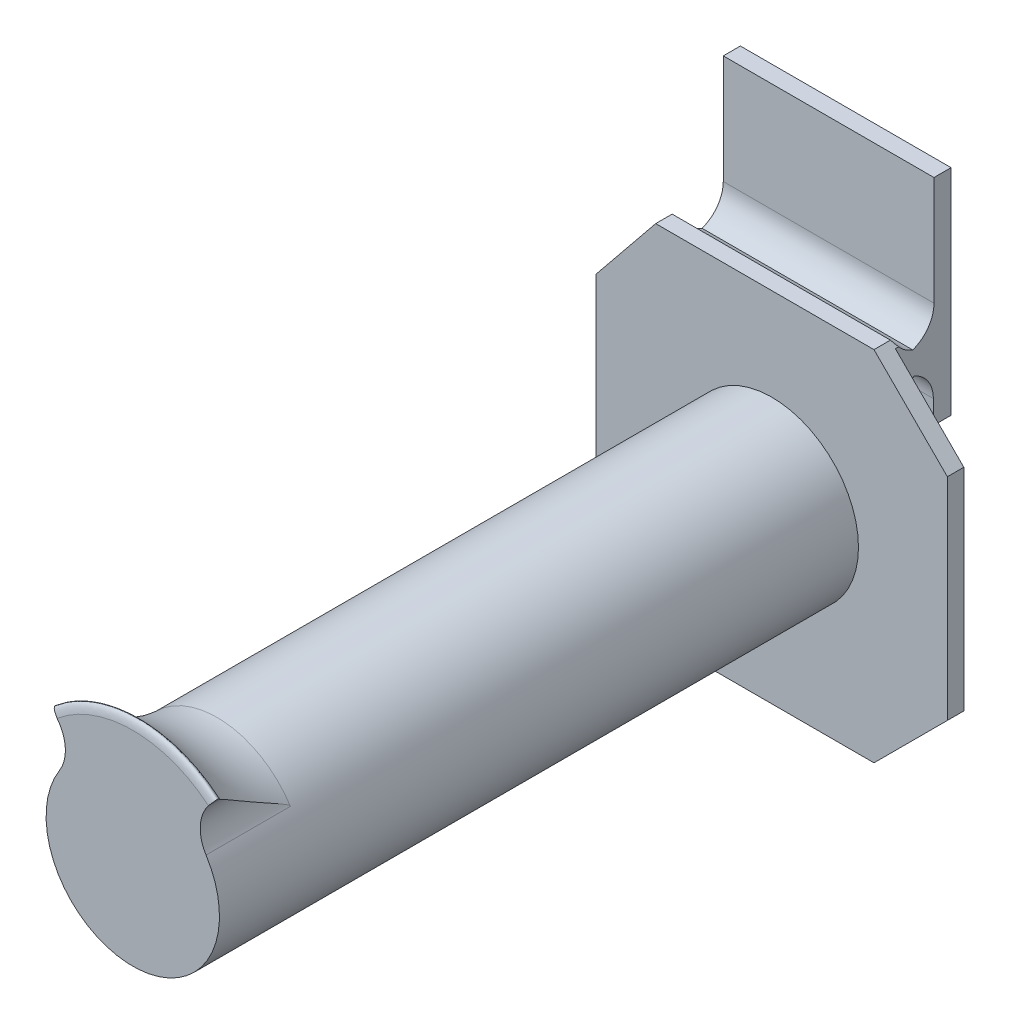
from build123d import *

# Parameters (mm, degrees)
SKETCH1_R                = 13.7
BOSS_EXTRUDE1_DEPTH      = 101
SKETCH5_W                = 55.5
SKETCH5_H                = 56.561345004
BOSS_EXTRUDE2_DEPTH      = 2.6
CUT_EXTRUDE4_DEPTH       = 2.6
BOSS_EXTRUDE4_DEPTH      = 6
SKETCH8_W                = 33.3
SKETCH8_H                = 11.7
BOSS_EXTRUDE5_DEPTH      = 2.8
SKETCH9_W                = 33.3
SKETCH9_H                = 2.7
BOSS_EXTRUDE6_DEPTH      = 22.2
FILLET2_R                = 5
REVOLVE1_ANGLE           = 40
REVOLVE1_OTHER_WAY_ANGLE = 40
FILLET4_R                = 6
FILLET5_R                = 6


with BuildPart() as part:
    # Sketch1 → Boss-Extrude1 (new body)
    with BuildSketch(Plane.XY):
        with Locations(Location((0, 0, 0), (0, 0, 180))):
            Circle(SKETCH1_R)
    extrude(amount=BOSS_EXTRUDE1_DEPTH)

    # Sketch5 → Boss-Extrude2 (add)
    with BuildSketch(Plane(origin=(0, 0, 0), x_dir=(-1, 0, 0), z_dir=(0, 0, -1))):
        Rectangle(SKETCH5_W, SKETCH5_H)
    extrude(amount=BOSS_EXTRUDE2_DEPTH)

    # Sketch6 → Cut-Extrude4 (cut)
    with BuildSketch(Plane(origin=(0, 0, -2.6), x_dir=(-1, 0, 0), z_dir=(0, 0, -1))):
        Polygon((27.75, 28.280672502), (18.35, 28.280672502), (27.75, 16.680672502), align=None)
        Polygon((-16.15, -28.280672502), (-27.75, -16.680672502), (-27.75, -28.280672502), align=None)
        Polygon((27.75, -18.880672502), (18.35, -28.280672502), (27.75, -28.280672502), align=None)
        Polygon((-27.75, 16.680672502), (-27.75, 28.280672502), (-16.15, 28.280672502), align=None)
    extrude(amount=-CUT_EXTRUDE4_DEPTH, mode=Mode.SUBTRACT)

    # Sketch7 → Boss-Extrude4 (add)
    with BuildSketch(Plane(origin=(0, 0, -2.6), x_dir=(-1, 0, 0), z_dir=(0, 0, -1))):
        Polygon((1.1, 25.680672502), (16.366645995, 25.680672502), (16.366645995, 22.680672502), (-16.933354005, 22.680672502), (-16.933354005, 25.680672502), align=None)
    extrude(amount=BOSS_EXTRUDE4_DEPTH)

    # Sketch8 → Boss-Extrude5 (add)
    with BuildSketch(Plane(origin=(0, 0, -8.6), x_dir=(-1, 0, 0), z_dir=(0, 0, -1))):
        with Locations((-0.283354005, 19.830672502)):
            Rectangle(SKETCH8_W, SKETCH8_H)
    extrude(amount=BOSS_EXTRUDE5_DEPTH)

    # Sketch9 → Boss-Extrude6 (add)
    with BuildSketch(Plane(origin=(0, 25.680672502, 0), x_dir=(1, 0, 0), z_dir=(0, 1, 0))):
        with Locations((0.283354005, 10.05)):
            Rectangle(SKETCH9_W, SKETCH9_H)
    extrude(amount=BOSS_EXTRUDE6_DEPTH)

    # Fillet2
    # the kernel refuses this fillet: 5 mm, written as the material it adds along each edge
    with BuildSketch(Plane(origin=(-16.366645995, 25.680672502, -2.6), x_dir=(0, 1, 0), z_dir=(1, 0, 0))) as fillet2_piece_1_section:
        with BuildLine():
            CenterArc((5, -4.38634244), FILLET2_R, 118.685402014, 61.314597986)
            Line((0, -4.38634244), (-0.1, -4.38634244))
            Line((-0.1, -4.38634244), (-0.1, 0))
            Line((-0.1, 0), (0, 0.1))
            ThreePointArc((0, 0.1), (1.3, 0.1), (2.552, 0.087726849))
            Line((2.552, 0.087726849), (2.6, 0))
        make_face()
    fillet2_piece_1 = extrude(amount=33.3, mode=Mode.PRIVATE)
    fillet2_piece_1 = split(fillet2_piece_1, bisect_by=Plane(origin=(9.175527955, 35.255144547, -3.690317045), z_dir=(-0.7071067811865442, -0.7071067811865509, 0)), keep=Keep.TOP, mode=Mode.PRIVATE)
    add(fillet2_piece_1)
    with BuildSketch(Plane(origin=(-16.366645995, 22.680672502, -2.6), x_dir=(0, -1, 0), z_dir=(1, 0, 0))) as fillet2_piece_2:
        with BuildLine():
            CenterArc((FILLET2_R, FILLET2_R), FILLET2_R, 180, 90)
            Line((0, FILLET2_R), (-FILLET2_R * 0.02, FILLET2_R))
            Line((-FILLET2_R * 0.02, FILLET2_R), (-FILLET2_R * 0.02, -FILLET2_R * 0.02))
            Line((-FILLET2_R * 0.02, -FILLET2_R * 0.02), (FILLET2_R, -FILLET2_R * 0.02))
            Line((FILLET2_R, -FILLET2_R * 0.02), (FILLET2_R, 0))
        make_face()
    extrude(amount=33.3)
    with BuildSketch(Plane(origin=(-16.366645995, 22.680672502, -8.6), x_dir=(0, -1, 0), z_dir=(1, 0, 0)), Plane(origin=(16.933354005, 25.680672502, -8.7), x_dir=(0, 1, 0), z_dir=(-1, 0, 0))) as fillet2_piece_3:
        with BuildLine():
            CenterArc((FILLET2_R, -FILLET2_R), FILLET2_R, 90, 90)
            Line((0, -FILLET2_R), (-FILLET2_R * 0.02, -FILLET2_R))
            Line((-FILLET2_R * 0.02, -FILLET2_R), (-FILLET2_R * 0.02, FILLET2_R * 0.02))
            Line((-FILLET2_R * 0.02, FILLET2_R * 0.02), (FILLET2_R, FILLET2_R * 0.02))
            Line((FILLET2_R, FILLET2_R * 0.02), (FILLET2_R, 0))
        make_face()
    extrude(amount=33.3)

    # Sketch10 → Revolve1 (revolve)
    with BuildSketch(Plane.ZY):
        with BuildLine():
            Line((101, 13.7), (101, 18.607528808))
            add(Edge.make_bspline(
                [(101, 18.607528808), (100.71882797, 21.282411004), (99.289162218, 18.607528808)],
                knots=[0, 0, 0, 1, 1, 1], degree=2))
            ThreePointArc((99.289162218, 18.607528808), (93.932259194, 15.08494276), (87.67231063, 13.7))
            Line((87.67231063, 13.7), (101, 13.7))
        make_face()
    revolve(axis=Axis((0, 0, 101.100764075), (0, 0, -1)), revolution_arc=REVOLVE1_ANGLE)

    # Sketch10 → Revolve1 other way (revolve)
    with BuildSketch(Plane.ZY):
        with BuildLine():
            Line((101, 13.7), (101, 18.607528808))
            add(Edge.make_bspline(
                [(101, 18.607528808), (100.71882797, 21.282411004), (99.289162218, 18.607528808)],
                knots=[0, 0, 0, 1, 1, 1], degree=2))
            ThreePointArc((99.289162218, 18.607528808), (93.932259194, 15.08494276), (87.67231063, 13.7))
            Line((87.67231063, 13.7), (101, 13.7))
        make_face()
    revolve(axis=Axis((0, 0, 101.100764075), (0, 0, 1)), revolution_arc=REVOLVE1_OTHER_WAY_ANGLE)

    # Fillet4
    fillet4_edges = [part.edges().sort_by_distance(p)[0] for p in [
        (8.806190253, 10.494808871, 94.336155315),
    ]]
    fillet(fillet4_edges, radius=FILLET4_R)

    # Fillet5
    fillet5_edges = [part.edges().sort_by_distance(p)[0] for p in [
        (-8.806190253, 10.494808871, 94.336155315),
    ]]
    fillet(fillet5_edges, radius=FILLET5_R)


solid = part.part
